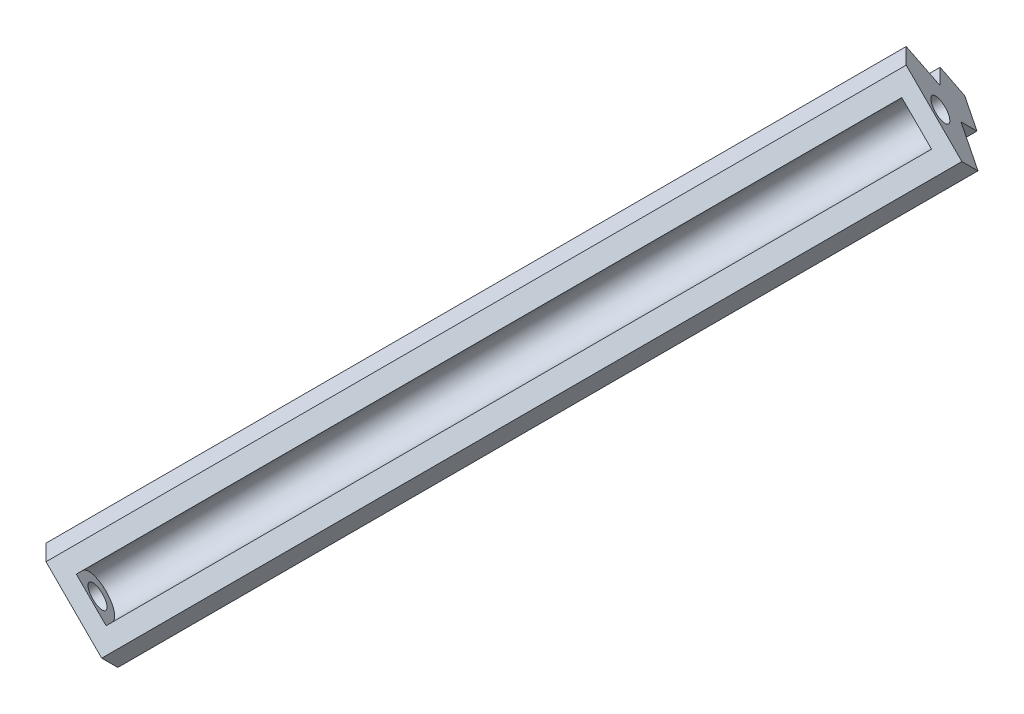
from build123d import *

# Parameters (mm, degrees)
STOCK_PFRD_START               = -164.049705188
STOCK_PFRD_JOINER_BASE_1_DEPTH = 99.013547962
BOSS_EXTRUDE1_DEPTH            = 99.013547962
CUT_EXTRUDE1_DEPTH             = 193.899706011
CUT_EXTRUDE1_DEPTH_BACK        = 193.899706011
SKETCH2_R                      = 1.55
CUT_EXTRUDE2_START             = -2
SKETCH2_3_R                    = 1.55
CUT_EXTRUDE2_DEPTH             = 95.013547962


# Read off the part's stored shape, not the designer's step: Stock-PFRD - Joiner Base-1
with BuildPart() as part:
    # Stock-PFRD - Joiner Base-1 outline → Stock-PFRD - Joiner Base-1 (new body)
    with BuildSketch(Plane(origin=(0, 0, 0), x_dir=(0.8164965809277251, -0.4082482904638628, 0.4082482904638649), z_dir=(0.5773502691896268, 0.5773502691896238, -0.5773502691896268)).offset(STOCK_PFRD_START)):
        Polygon((-62.189823503, 111.644137252), (-62.189823503, 114.644137252), (-66.189823503, 114.644137252), (-68.189823503, 111.180035637), (-65.591747292, 109.680035637), (-68.354247292, 104.895245281), (-67.382105967, 104.333979225), (-63.809678479, 110.521605141), (-56.664823503, 110.521605141), (-56.664823503, 111.644137252), align=None)
    extrude(amount=STOCK_PFRD_JOINER_BASE_1_DEPTH)

    # Sketch1 → Boss-Extrude1 (add)
    with BuildSketch(Plane(origin=(-37.548642882, -37.548642882, 37.548642882), x_dir=(-0.4082482904638644, -0.40824829046386246, -0.8164965809277256), z_dir=(0.5773502691896268, 0.5773502691896242, -0.5773502691896264))):
        Polygon((124.046929471, 6.187625915), (122.393930478, 5.233266502), (122.393930478, -5.233266502), (124.046929471, -6.187625915), (126.031643718, -2.75), (127.619356958, 0), (126.031643718, 2.75), align=None)
    extrude(amount=-BOSS_EXTRUDE1_DEPTH)

    # Sketch2 → Cut-Extrude1 (cut, two sides: drawn at the far end of the back side and taken through both)
    with BuildSketch(Plane(origin=(-37.548642882, -37.548642882, 37.548642882), x_dir=(-0.4082482904638644, -0.40824829046386246, -0.8164965809277256), z_dir=(0.5773502691896268, 0.5773502691896242, -0.5773502691896264)).offset(-CUT_EXTRUDE1_DEPTH_BACK)):
        with Locations(Location((124.443930478, 0, 0), (0, 0, 30))):
            Circle(SKETCH2_R)
    extrude(amount=CUT_EXTRUDE1_DEPTH + CUT_EXTRUDE1_DEPTH_BACK, mode=Mode.SUBTRACT)

    # Sketch2<3> → Cut-Extrude2 (cut)
    with BuildSketch(Plane(origin=(-37.548642882, -37.548642882, 37.548642882), x_dir=(-0.4082482904638644, -0.40824829046386246, -0.8164965809277256), z_dir=(0.5773502691896268, 0.5773502691896242, -0.5773502691896264)).offset(CUT_EXTRUDE2_START)):
        with BuildLine():
            Line((122.393930478, 2.799999988), (124.443930478, 2.799999988))
            ThreePointArc((124.443930478, 2.799999988), (127.243930466, 0), (124.443930478, -2.799999988))
            Line((124.443930478, -2.799999988), (122.393930478, -2.799999988))
            ThreePointArc((122.393930478, -2.799999988), (119.59393049, 0), (122.393930478, 2.799999988))
        make_face()
        with Locations(Location((124.443930478, 0, 0), (0, 0, 30))):
            Circle(SKETCH2_3_R, mode=Mode.SUBTRACT)
    extrude(amount=-CUT_EXTRUDE2_DEPTH, mode=Mode.SUBTRACT)


solid = part.part
